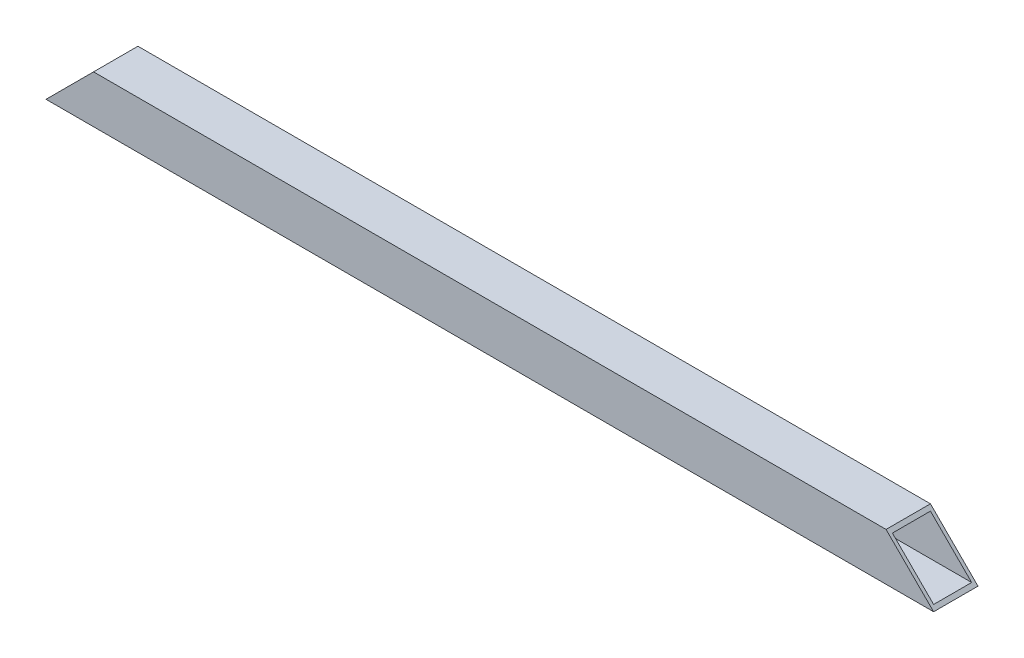
from build123d import *

# Parameters (mm, degrees)
SKETCH_2_W          = 70
SKETCH_2_H          = 75
SKETCH_2_W_2        = 60
SKETCH_2_H_2        = 65
EXTRUDE_1_DEPTH     = 1400
SKETCH_3_OUTSIDE_W  = 1682.75
SKETCH_3_OUTSIDE_H  = 357.75
CUT_EXTRUDE_1_DEPTH = 1403.250423427


with BuildPart() as part:
    # Эскиз2 → Вытянуть-Тонкостенный1 (new body)
    with BuildSketch(Plane(origin=(0, 0, 0), x_dir=(0, 0, -1), z_dir=(1, 0, 0))):
        Rectangle(SKETCH_2_W, SKETCH_2_H)
        Rectangle(SKETCH_2_W_2, SKETCH_2_H_2, mode=Mode.SUBTRACT)
    extrude(amount=EXTRUDE_1_DEPTH)

    # Эскиз3 outside → Вырез-Вытянуть1 (cut, through all)
    with BuildSketch(Plane(origin=(0, 0, -35), x_dir=(-1, 0, 0), z_dir=(0, 0, -1))):
        with Locations((-700, 0)):
            Rectangle(SKETCH_3_OUTSIDE_W, SKETCH_3_OUTSIDE_H)
        Polygon((-1400, -37.5), (-1325, 37.5), (-75, 37.5), (0, -37.5), align=None, mode=Mode.SUBTRACT)
    extrude(amount=-CUT_EXTRUDE_1_DEPTH, mode=Mode.SUBTRACT)


solid = part.part
